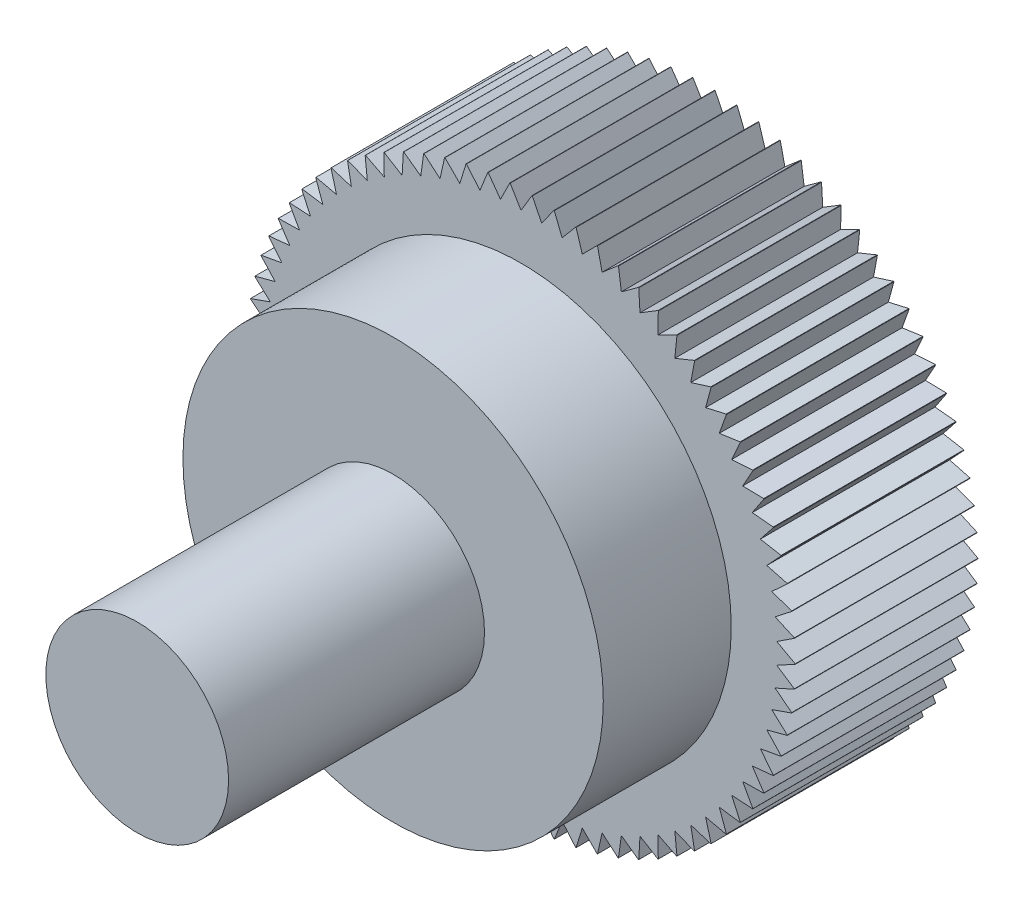
from build123d import *

# Parameters (mm, degrees)
SKETCH1_R          = 7.5
EXTRUDE1_DEPTH     = 5
SKETCH2_R          = 5.75
EXTRUDE2_DEPTH     = 3.5
SKETCH3_R          = 2.5
EXTRUDE3_DEPTH     = 7
CUT_EXTRUDE1_DEPTH = 20
SKETCH5_R          = 4
CUT_EXTRUDE2_DEPTH = 0.5


with BuildPart() as part:
    # Sketch1 → Extrude1 (new body)
    with BuildSketch(Plane.XY):
        Circle(SKETCH1_R)
    extrude(amount=EXTRUDE1_DEPTH)

    # Sketch2 → Extrude2 (add)
    with BuildSketch(Plane.XY.offset(5)):
        Circle(SKETCH2_R)
    extrude(amount=EXTRUDE2_DEPTH)

    # Sketch3 → Extrude3 (add)
    with BuildSketch(Plane.XY.offset(8.5)):
        Circle(SKETCH3_R)
    extrude(amount=EXTRUDE3_DEPTH)

    # Sketch4 → Cut-Extrude1 (cut)
    with BuildSketch(Plane(origin=(0, 0, 0), x_dir=(-1, 0, 0), z_dir=(0, 0, -1))):
        Polygon((-0.3, 7.5), (0, 7), (0.3, 7.5), align=None)
        Polygon((0.304472073, 7.499819782), (0.563265981, 6.977301157), (0.902526458, 7.45153984), align=None)
        Polygon((0.906969528, 7.451000354), (1.122878966, 6.909351838), (1.499199685, 7.354753586), align=None)
        Polygon((1.503584937, 7.35385833), (1.67520965, 6.796592722), (2.086150027, 7.210268931), align=None)
        Polygon((2.090449021, 7.209023713), (2.216675957, 6.639755094), (2.659570886, 7.019022916), align=None)
        Polygon((2.663755741, 7.01743581), (2.743766269, 6.439856106), (3.215743407, 6.782255844), align=None)
        Polygon((3.219786983, 6.780337144), (3.253062204, 6.19819218), (3.751060598, 6.501503241), align=None)
        Polygon((3.75493667, 6.499265389), (3.741260783, 5.916330599), (4.262050722, 6.178585894), align=None)
        Polygon((4.265734153, 6.176043405), (4.20519585, 5.596099344), (4.745399811, 5.815598046), align=None)
        Polygon((4.748866712, 5.812767409), (4.641858608, 5.239575237), (5.197973161, 5.414893814), align=None)
        Polygon((5.201201049, 5.411793386), (5.048417131, 4.849070475), (5.616835661, 4.979071917), align=None)
        Polygon((5.619803601, 4.975721806), (5.422234733, 4.427117629), (5.999270826, 4.510958828), align=None)
        Polygon((6.00195957, 4.50738076), (5.760887061, 3.976453227), (6.342798418, 4.013590441), align=None)
        Polygon((6.345190528, 4.009807621), (6.062177826, 3.5), (6.645190528, 3.490192379), align=None)
        Polygon((6.647270491, 3.486229341), (6.324153042, 3.00084793), (6.904486028, 2.94415908), align=None)
        Polygon((6.906240354, 2.940041526), (6.545113699, 2.482234209), (7.119003286, 2.37903178), align=None)
        Polygon((7.120420598, 2.374786413), (6.723626781, 1.947522247), (7.287351076, 1.798475546), align=None)
        Polygon((7.288422182, 1.794129899), (6.858534564, 1.400179856), (7.408437598, 1.206255508), align=None)
        Polygon((7.409155552, 1.201837764), (6.948962119, 0.843756762), (7.48147756, 0.60621244), align=None)
        Polygon((7.481837704, 0.60175125), (6.994322987, 0.281861581), (7.505997268, 0.002237851), align=None)
        Polygon((7.505997268, -0.002237851), (6.994322987, -0.281861581), (7.481837704, -0.60175125), align=None)
        Polygon((7.48147756, -0.60621244), (6.948962119, -0.843756762), (7.409155552, -1.201837764), align=None)
        Polygon((7.408437598, -1.206255508), (6.858534564, -1.400179856), (7.288422182, -1.794129899), align=None)
        Polygon((7.287351076, -1.798475546), (6.723626781, -1.947522247), (7.120420598, -2.374786413), align=None)
        Polygon((7.119003286, -2.37903178), (6.545113699, -2.482234209), (6.906240354, -2.940041526), align=None)
        Polygon((6.904486028, -2.94415908), (6.324153042, -3.00084793), (6.647270491, -3.486229341), align=None)
        Polygon((6.645190528, -3.490192379), (6.062177826, -3.5), (6.345190528, -4.009807621), align=None)
        Polygon((6.342798418, -4.013590441), (5.760887061, -3.976453227), (6.00195957, -4.50738076), align=None)
        Polygon((5.999270826, -4.510958828), (5.422234733, -4.427117629), (5.619803601, -4.975721806), align=None)
        Polygon((5.616835661, -4.979071917), (5.048417131, -4.849070475), (5.201201049, -5.411793386), align=None)
        Polygon((5.197973161, -5.414893814), (4.641858608, -5.239575237), (4.748866712, -5.812767409), align=None)
        Polygon((4.745399811, -5.815598046), (4.20519585, -5.596099344), (4.265734153, -6.176043405), align=None)
        Polygon((4.262050722, -6.178585894), (3.741260783, -5.916330599), (3.75493667, -6.499265389), align=None)
        Polygon((3.751060598, -6.501503241), (3.253062204, -6.19819218), (3.219786983, -6.780337144), align=None)
        Polygon((3.215743407, -6.782255844), (2.743766269, -6.439856106), (2.663755741, -7.01743581), align=None)
        Polygon((2.659570886, -7.019022916), (2.216675957, -6.639755094), (2.090449021, -7.209023713), align=None)
        Polygon((2.086150027, -7.210268931), (1.67520965, -6.796592722), (1.503584937, -7.35385833), align=None)
        Polygon((1.499199685, -7.354753586), (1.122878966, -6.909351838), (0.906969528, -7.451000354), align=None)
        Polygon((0.902526458, -7.45153984), (0.563265981, -6.977301157), (0.304472073, -7.499819782), align=None)
        Polygon((0.3, -7.5), (0, -7), (-0.3, -7.5), align=None)
        Polygon((-0.304472073, -7.499819782), (-0.563265981, -6.977301157), (-0.902526458, -7.45153984), align=None)
        Polygon((-0.906969528, -7.451000354), (-1.122878966, -6.909351838), (-1.499199685, -7.354753586), align=None)
        Polygon((-1.503584937, -7.35385833), (-1.67520965, -6.796592722), (-2.086150027, -7.210268931), align=None)
        Polygon((-2.090449021, -7.209023713), (-2.216675957, -6.639755094), (-2.659570886, -7.019022916), align=None)
        Polygon((-2.663755741, -7.01743581), (-2.743766269, -6.439856106), (-3.215743407, -6.782255844), align=None)
        Polygon((-3.219786983, -6.780337144), (-3.253062204, -6.19819218), (-3.751060598, -6.501503241), align=None)
        Polygon((-3.75493667, -6.499265389), (-3.741260783, -5.916330599), (-4.262050722, -6.178585894), align=None)
        Polygon((-4.265734153, -6.176043405), (-4.20519585, -5.596099344), (-4.745399811, -5.815598046), align=None)
        Polygon((-4.748866712, -5.812767409), (-4.641858608, -5.239575237), (-5.197973161, -5.414893814), align=None)
        Polygon((-5.201201049, -5.411793386), (-5.048417131, -4.849070475), (-5.616835661, -4.979071917), align=None)
        Polygon((-5.619803601, -4.975721806), (-5.422234733, -4.427117629), (-5.999270826, -4.510958828), align=None)
        Polygon((-6.00195957, -4.50738076), (-5.760887061, -3.976453227), (-6.342798418, -4.013590441), align=None)
        Polygon((-6.345190528, -4.009807621), (-6.062177826, -3.5), (-6.645190528, -3.490192379), align=None)
        Polygon((-6.647270491, -3.486229341), (-6.324153042, -3.00084793), (-6.904486028, -2.94415908), align=None)
        Polygon((-6.906240354, -2.940041526), (-6.545113699, -2.482234209), (-7.119003286, -2.37903178), align=None)
        Polygon((-7.120420598, -2.374786413), (-6.723626781, -1.947522247), (-7.287351076, -1.798475546), align=None)
        Polygon((-7.288422182, -1.794129899), (-6.858534564, -1.400179856), (-7.408437598, -1.206255508), align=None)
        Polygon((-7.409155552, -1.201837764), (-6.948962119, -0.843756762), (-7.48147756, -0.60621244), align=None)
        Polygon((-7.481837704, -0.60175125), (-6.994322987, -0.281861581), (-7.505997268, -0.002237851), align=None)
        Polygon((-7.505997268, 0.002237851), (-6.994322987, 0.281861581), (-7.481837704, 0.60175125), align=None)
        Polygon((-7.48147756, 0.60621244), (-6.948962119, 0.843756762), (-7.409155552, 1.201837764), align=None)
        Polygon((-7.408437598, 1.206255508), (-6.858534564, 1.400179856), (-7.288422182, 1.794129899), align=None)
        Polygon((-7.287351076, 1.798475546), (-6.723626781, 1.947522247), (-7.120420598, 2.374786413), align=None)
        Polygon((-7.119003286, 2.37903178), (-6.545113699, 2.482234209), (-6.906240354, 2.940041526), align=None)
        Polygon((-6.904486028, 2.94415908), (-6.324153042, 3.00084793), (-6.647270491, 3.486229341), align=None)
        Polygon((-6.645190528, 3.490192379), (-6.062177826, 3.5), (-6.345190528, 4.009807621), align=None)
        Polygon((-6.342798418, 4.013590441), (-5.760887061, 3.976453227), (-6.00195957, 4.50738076), align=None)
        Polygon((-5.999270826, 4.510958828), (-5.422234733, 4.427117629), (-5.619803601, 4.975721806), align=None)
        Polygon((-5.616835661, 4.979071917), (-5.048417131, 4.849070475), (-5.201201049, 5.411793386), align=None)
        Polygon((-5.197973161, 5.414893814), (-4.641858608, 5.239575237), (-4.748866712, 5.812767409), align=None)
        Polygon((-4.745399811, 5.815598046), (-4.20519585, 5.596099344), (-4.265734153, 6.176043405), align=None)
        Polygon((-4.262050722, 6.178585894), (-3.741260783, 5.916330599), (-3.75493667, 6.499265389), align=None)
        Polygon((-3.751060598, 6.501503241), (-3.253062204, 6.19819218), (-3.219786983, 6.780337144), align=None)
        Polygon((-3.215743407, 6.782255844), (-2.743766269, 6.439856106), (-2.663755741, 7.01743581), align=None)
        Polygon((-2.659570886, 7.019022916), (-2.216675957, 6.639755094), (-2.090449021, 7.209023713), align=None)
        Polygon((-2.086150027, 7.210268931), (-1.67520965, 6.796592722), (-1.503584937, 7.35385833), align=None)
        Polygon((-1.499199685, 7.354753586), (-1.122878966, 6.909351838), (-0.906969528, 7.451000354), align=None)
        Polygon((-0.902526458, 7.45153984), (-0.563265981, 6.977301157), (-0.304472073, 7.499819782), align=None)
    extrude(amount=-CUT_EXTRUDE1_DEPTH, mode=Mode.SUBTRACT)

    # Sketch5 → Cut-Extrude2 (cut)
    with BuildSketch(Plane(origin=(0, 0, 0), x_dir=(-1, 0, 0), z_dir=(0, 0, -1))):
        Circle(SKETCH5_R)
    extrude(amount=-CUT_EXTRUDE2_DEPTH, mode=Mode.SUBTRACT)


solid = part.part
